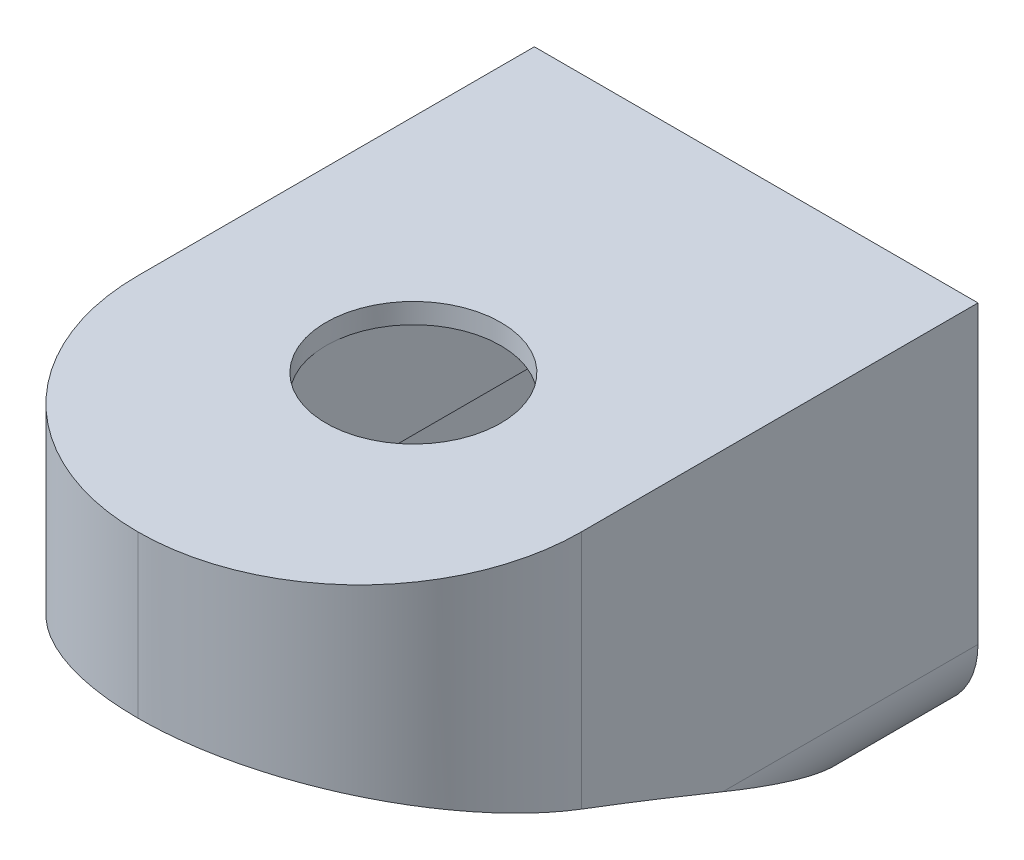
from build123d import *

# Parameters (mm, degrees)
SKETCH1_W           = 33
SKETCH1_H           = 28
BOSS_EXTRUDE1_DEPTH = 46
CUT_EXTRUDE1_DEPTH  = 59.318093247
CUT_EXTRUDE4_START  = -3
CUT_EXTRUDE4_DEPTH  = 27
FILLET1_R           = 12.5
FILLET2_R           = 16.5
FILLET3_R           = 6
SKETCH5_W           = 13
SKETCH5_H           = 23
CUT_EXTRUDE8_DEPTH  = 9
SKETCH6_R           = 6.5
CUT_EXTRUDE9_DEPTH  = 56.592265809
SKETCH7_R           = 1
CUT_EXTRUDE10_DEPTH = 8
SKETCH8_R           = 0.925072744
SKETCH8_R_2         = 2.5
CUT_EXTRUDE11_DEPTH = 2.5


with BuildPart() as part:
    # Sketch1 → Boss-Extrude1 (new body)
    with BuildSketch(Plane.XY):
        Rectangle(SKETCH1_W, SKETCH1_H)
    extrude(amount=BOSS_EXTRUDE1_DEPTH)

    # Sketch3 → Cut-Extrude1 (cut, through all)
    with BuildSketch(Plane(origin=(16.5, 0, 0), x_dir=(0, 0, -1), z_dir=(1, 0, 0))):
        with BuildLine():
            Line((-46, 2), (-46, -14))
            Line((-46, -14), (-5, -14))
            add(Edge.make_bspline(
                [(-5, -14), (-25.11965555, -4.947029267), (-46, 2)],
                knots=[0, 0, 0, 1, 1, 1], degree=2))
        make_face()
    extrude(amount=-CUT_EXTRUDE1_DEPTH, mode=Mode.SUBTRACT)

    # Sketch4 → Cut-Extrude4 (cut)
    with BuildSketch(Plane(origin=(16.5, 0, 0), x_dir=(0, 0, -1), z_dir=(1, 0, 0)).offset(CUT_EXTRUDE4_START)):
        with BuildLine():
            Line((-5, -14), (-2.5, -14))
            Line((-2.5, -14), (-2.5, 3.5))
            Line((-2.5, 3.5), (-40.5, 3.5))
            Line((-40.5, 3.5), (-40.5, 0.128997137))
            add(Edge.make_bspline(
                [(-5, -14), (-22.463452761, -6.142205101), (-40.5, 0.128997137)],
                knots=[0, 0, 0, 1, 1, 1], degree=2))
        make_face()
    extrude(amount=-CUT_EXTRUDE4_DEPTH, mode=Mode.SUBTRACT)

    # Fillet1
    fillet1_edges = [part.edges().sort_by_distance(p)[0] for p in [
        (13.5, 1.814498569, 40.5),
        (-13.5, 1.814498569, 40.5),
    ]]
    fillet(fillet1_edges, radius=FILLET1_R)

    # Fillet2
    fillet2_edges = [part.edges().sort_by_distance(p)[0] for p in [
        (-16.5, 8, 46),
        (16.5, 8, 46),
    ]]
    fillet(fillet2_edges, radius=FILLET2_R - 0.0001)  # a hair under: the kernel refuses the full size

    # Fillet3
    fillet3_edges = [part.edges().sort_by_distance(p)[0] for p in [
        (-16.5, -14, 2.5),
        (16.5, -14, 2.5),
    ]]
    fillet(fillet3_edges, radius=FILLET3_R)

    # Sketch5 → Cut-Extrude8 (cut)
    with BuildSketch(Plane.XZ.offset(-3.5)):
        with Locations((0, 20.5)):
            Rectangle(SKETCH5_W, SKETCH5_H)
    extrude(amount=-CUT_EXTRUDE8_DEPTH, mode=Mode.SUBTRACT)

    # Sketch6 → Cut-Extrude9 (cut, through all)
    with BuildSketch(Plane.XZ.offset(-12.5)):
        with Locations(Location((0, 25.5, 0), (0, 0, 270))):
            Circle(SKETCH6_R)
    extrude(amount=-CUT_EXTRUDE9_DEPTH, mode=Mode.SUBTRACT)

    # Sketch7 → Cut-Extrude10 (cut)
    with BuildSketch(Plane.XZ.offset(-3.5)):
        with Locations(Location((0, 34.3, 0), (0, 0, 270))):
            Circle(SKETCH7_R)
        with Locations(Location((0, 6.7, 0), (0, 0, 270))):
            Circle(SKETCH7_R)
    extrude(amount=-CUT_EXTRUDE10_DEPTH, mode=Mode.SUBTRACT)

    # Sketch8 → Cut-Extrude11 (cut)
    with BuildSketch(Plane(origin=(0, 0, 0), x_dir=(-1, 0, 0), z_dir=(0, 0, -1))):
        with Locations((-9.5, 0)):
            Circle(SKETCH8_R)
        with Locations((-5, 0)):
            Circle(SKETCH8_R_2)
        with Locations((-0.5, 0)):
            Circle(SKETCH8_R)
    extrude(amount=-CUT_EXTRUDE11_DEPTH, mode=Mode.SUBTRACT)


solid = part.part
